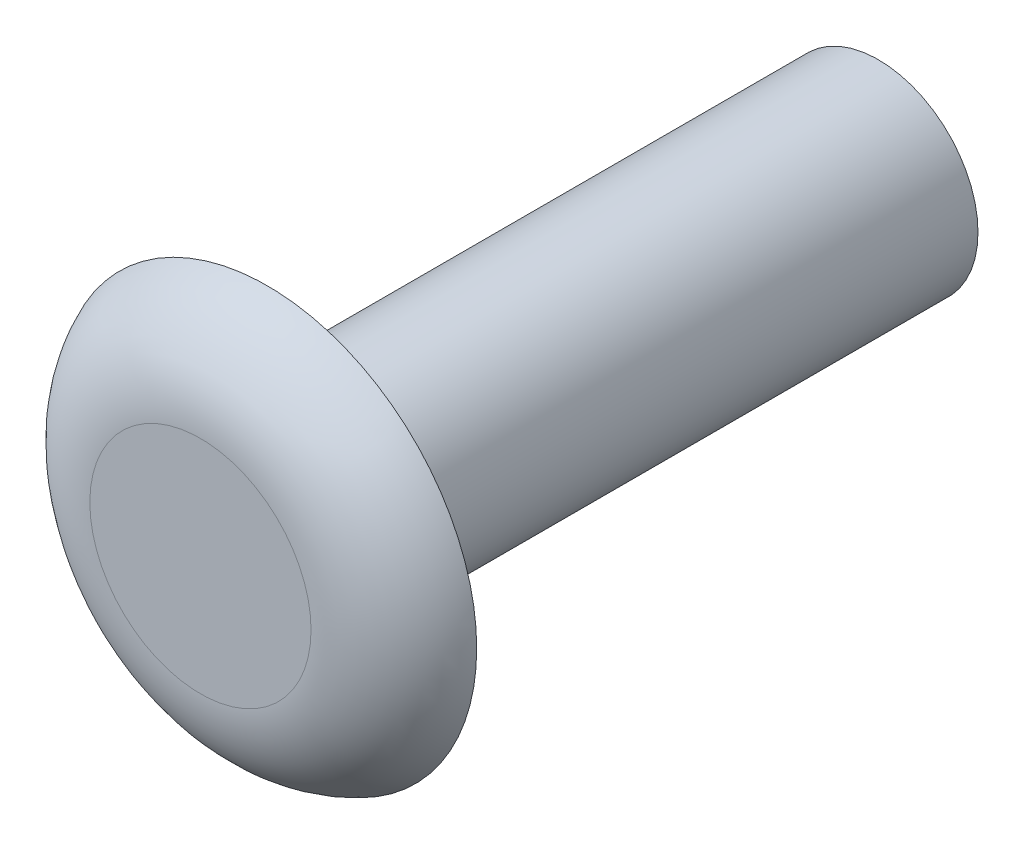
from build123d import *

# Parameters (mm, degrees)
SKETCH1_R           = 5.0038
BOSS_EXTRUDE1_DEPTH = 1.6002
SKETCH2_R           = 2.38125
BOSS_EXTRUDE2_DEPTH = 14.605
FILLET1_R           = 2.54


with BuildPart() as part:
    # Sketch1 → Boss-Extrude1 (new body)
    with BuildSketch(Plane.XY):
        Circle(SKETCH1_R)
    extrude(amount=BOSS_EXTRUDE1_DEPTH)

    # Sketch2 → Boss-Extrude2 (add)
    with BuildSketch(Plane.XY):
        Circle(SKETCH2_R)
    extrude(amount=-BOSS_EXTRUDE2_DEPTH)

    # Fillet1
    # the kernel refuses this fillet: 2.54 mm, written as the material it takes off along each edge
    with BuildSketch(Plane(origin=(0, 0, 1.6002), x_dir=(1, 0, 0), z_dir=(0, -1, 0))) as fillet1_piece_1:
        with BuildLine():
            CenterArc((2.644059345, -2.54), FILLET1_R, 21.715617283, 68.284382717)
            Line((2.644059345, 0), (2.644059345, 0.0508))
            Line((2.644059345, 0.0508), (5.0038, 0.0508))
            Line((5.0038, 0.0508), (5.0546, 0))
            ThreePointArc((5.0546, 0), (5.0546, -0.8001), (5.050994813, -1.581404))
            Line((5.050994813, -1.581404), (5.0038, -1.6002))
        make_face()
    revolve(axis=Axis((0, 0, 1.6002), (0, 0, 1)), mode=Mode.SUBTRACT)


solid = part.part
